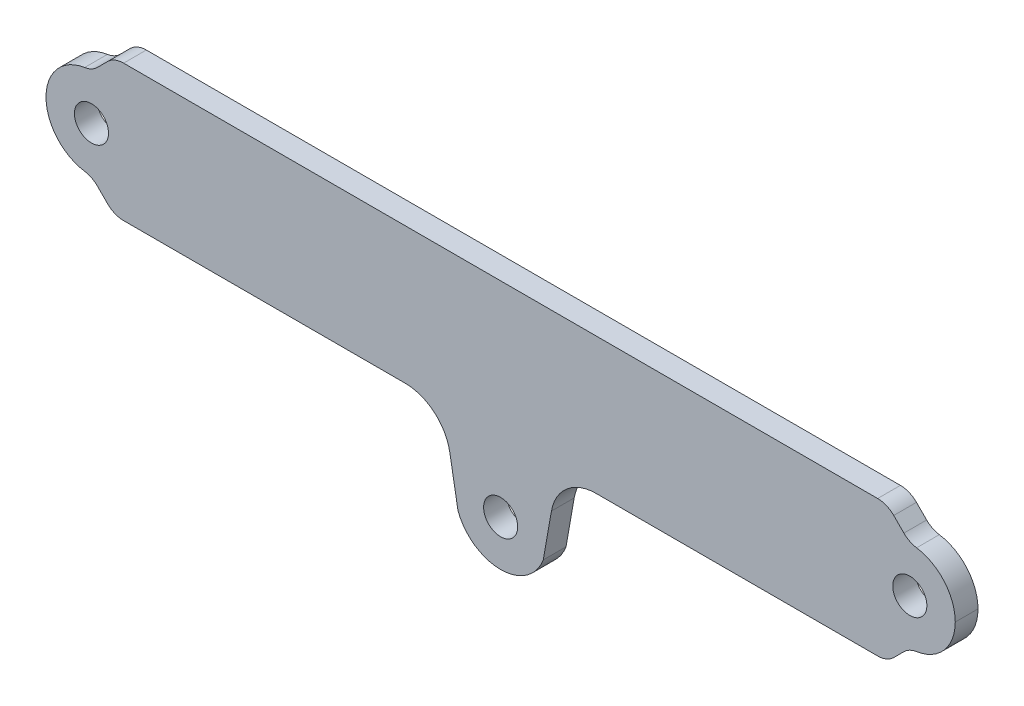
from build123d import *

# Parameters (mm, degrees)
SKETCH1_R           = 1.905
BOSS_EXTRUDE1_DEPTH = 2.54
FILLET5_R           = 5.08
FILLET6_R           = 2.54


with BuildPart() as part:
    # Sketch1 → Boss-Extrude1 (new body)
    with BuildSketch(Plane.XY):
        with BuildLine():
            Line((5.08, 10.16), (7.62, 12.7))
            Line((7.62, 12.7), (50.8, 12.7))
            Line((50.8, 12.7), (50.8, -2.54))
            Line((50.8, -2.54), (50.8, -8.255))
            ThreePointArc((50.8, -8.255), (48.895, -10.16), (50.8, -12.065))
            Line((50.8, -12.065), (50.8, -15.24))
            ThreePointArc((50.8, -15.24), (47.896976236, -14.328795153), (46.035389215, -11.922068121))
            Line((46.035389215, -11.922068121), (44.38107747, -2.54))
            Line((44.38107747, -2.54), (7.62, -2.54))
            Line((7.62, -2.54), (5.08, 0))
            Line((5.08, 0), (0, 0))
            Line((0, 0), (0, 10.16))
            Line((0, 10.16), (5.08, 10.16))
        make_face()
        with Locations((5.08, 5.08)):
            Circle(SKETCH1_R, mode=Mode.SUBTRACT)
    extrude(amount=BOSS_EXTRUDE1_DEPTH)

    # Fillet5
    fillet5_edges = [part.edges().sort_by_distance(p)[0] for p in [
        (44.38107747, -2.54, 1.27),
        (0, 0, 1.27),
        (0, 10.16, 1.27),
    ]]
    fillet(fillet5_edges, radius=FILLET5_R - 0.0001)  # a hair under: the kernel refuses the full size

    # Fillet6
    fillet6_edges = [part.edges().sort_by_distance(p)[0] for p in [
        (5.08, 10.16, 1.27),
        (7.62, 12.7, 1.27),
        (7.62, -2.54, 1.27),
        (5.08, 0, 1.27),
    ]]
    fillet(fillet6_edges, radius=FILLET6_R)

    # Mirror5: part across plane


with BuildPart() as part_1:
    add(part.part)
    add(part.part.mirror(Plane(origin=(50.8, -2.54, 2.54), x_dir=(0, 0, 1), z_dir=(-1, 0, 0))))


solid = part_1.part
